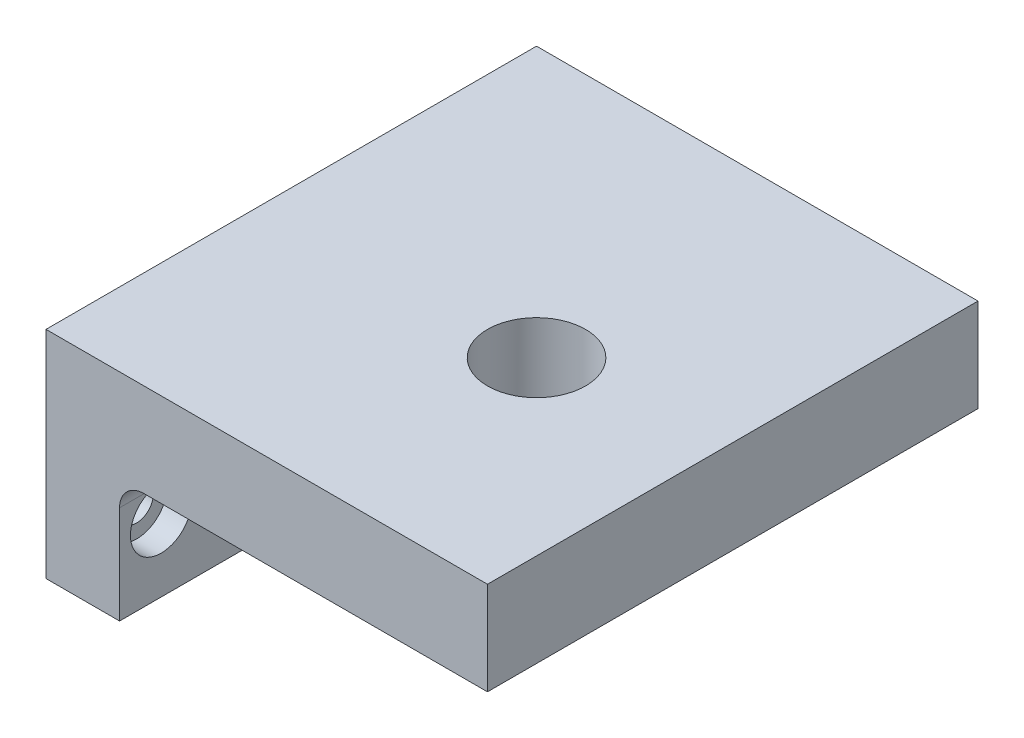
from build123d import *

# Parameters (mm, degrees)
BOSS_EXTRUDE1_DEPTH = 50.8
SKETCH2_R           = 1.7399
CUT_EXTRUDE1_DEPTH  = 45.72
FILLET1_R           = 2.54
SKETCH11_R          = 3.175
CUT_EXTRUDE5_DEPTH  = 2.54
SKETCH12_R          = 5.08
CUT_EXTRUDE6_DEPTH  = 72.906677743


with BuildPart() as part:
    # Sketch1 → Boss-Extrude1 (new body)
    with BuildSketch(Plane.XY):
        Polygon((0, 0), (0, -22.352), (7.62, -22.352), (7.62, -9.652), (45.72, -9.652), (45.72, 0), align=None)
    extrude(amount=BOSS_EXTRUDE1_DEPTH)

    # Sketch2 → Cut-Extrude1 (cut)
    with BuildSketch(Plane.ZY):
        with Locations((4.3, -15.24)):
            Circle(SKETCH2_R)
        with Locations((46.5, -15.24)):
            Circle(SKETCH2_R)
    extrude(amount=-CUT_EXTRUDE1_DEPTH, mode=Mode.SUBTRACT)

    # Fillet1
    fillet1_edges = [part.edges().sort_by_distance(p)[0] for p in [
        (7.62, -9.652, 25.4),
    ]]
    fillet(fillet1_edges, radius=FILLET1_R)

    # Sketch11 → Cut-Extrude5 (cut)
    with BuildSketch(Plane(origin=(7.62, 0, 0), x_dir=(0, 0, -1), z_dir=(1, 0, 0))):
        with Locations((-46.5, -15.24)):
            Circle(SKETCH11_R)
        with Locations((-4.3, -15.24)):
            Circle(SKETCH11_R)
    extrude(amount=-CUT_EXTRUDE5_DEPTH, mode=Mode.SUBTRACT)

    # Sketch12 → Cut-Extrude6 (cut, through all)
    with BuildSketch(Plane(origin=(0, 0, 0), x_dir=(1, 0, 0), z_dir=(0, 1, 0))):
        with Locations((27.94, -27.94)):
            Circle(SKETCH12_R)
    extrude(amount=-CUT_EXTRUDE6_DEPTH, mode=Mode.SUBTRACT)


solid = part.part
